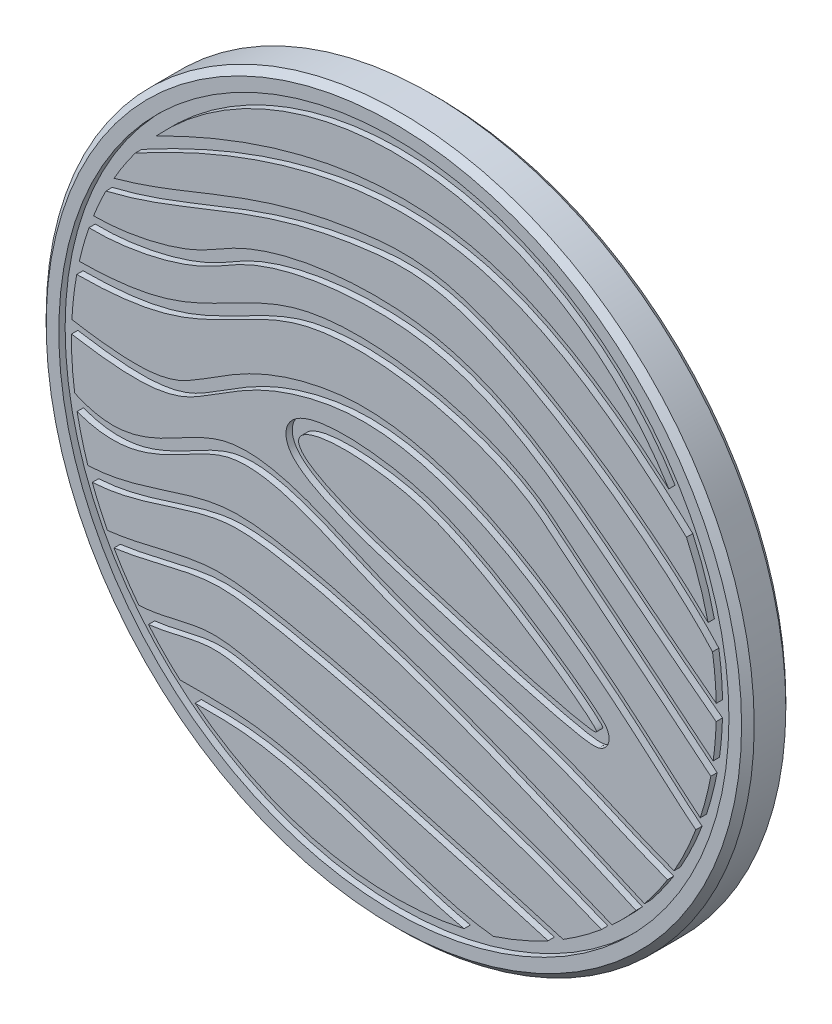
from build123d import *

# Parameters (mm, degrees)
SKETCH2_R                 = 44.45
BOSS_EXTRUDE1_DEPTH       = 5.55625
CHAMFER1_SIZE             = 0.79375
F_6_32_TAPPED_HOLE1_D     = 2.7051
F_6_32_TAPPED_HOLE1_DEPTH = 4.26730597
F_6_32_TAPPED_HOLE1_TIP   = 0.81269403
THREAD1_PITCH             = 0.79375
CIRPATTERN1_COUNT         = 3
CUT_EXTRUDE1_START        = -0.79375
CUT_EXTRUDE1_DEPTH        = 0.79375
SKETCH11_R                = 43.65625
SKETCH11_R_2              = 42.06875
BOSS_EXTRUDE2_DEPTH       = 5.55625
SKETCH11_3_R              = 42.06875
SKETCH11_3_R_2            = 40.48125
CUT_EXTRUDE2_DEPTH        = 0.79375


# Read off the part's stored shape, not the designer's step: Cut-Extrude1
with BuildPart() as part:
    # Sketch2 → Boss-Extrude1 (new body)
    with BuildSketch(Plane.XY):
        Circle(SKETCH2_R)
    extrude(amount=BOSS_EXTRUDE1_DEPTH)

    # Chamfer1
    chamfer1_edges = [part.edges().sort_by_distance(p)[0] for p in [
        (-44.45, 0, 0),
        (-44.45, 0, 5.55625),
    ]]
    chamfer(chamfer1_edges, length=CHAMFER1_SIZE)

    # #6-32 Tapped Hole1
    with Locations(Plane(origin=(0, 0, 0), x_dir=(-1, 0, 0), z_dir=(0, 0, -1))):
        with Locations((-21.997045256, -12.7), (0, 25.4), (21.997045256, -12.7)):
            Hole(F_6_32_TAPPED_HOLE1_D / 2, depth=F_6_32_TAPPED_HOLE1_DEPTH)
            with Locations((0, 0, -(F_6_32_TAPPED_HOLE1_DEPTH + F_6_32_TAPPED_HOLE1_TIP / 2))):  # 118° drill point
                Cone(0, F_6_32_TAPPED_HOLE1_D / 2, F_6_32_TAPPED_HOLE1_TIP, mode=Mode.SUBTRACT)

    # Thread1: the profile of Thread Profile1 profile screwed along a right-hand helix of 9.44 turns, 8 arcs to a turn; built about Z, then put on its axis
    thread1_z = Axis((0, 0, 0), (0, 0, 1))
    thread1_corners = [(1.35225, 0, -0.000173205), (1.782179788, 0, 0.248046874), (1.782179788, 0, 0.347265624), (1.35225, 0, 0.595485703)]
    with BuildLine(mode=Mode.PRIVATE) as thread1_profile:
        Line(thread1_corners[0], thread1_corners[1])
        Line(thread1_corners[1], thread1_corners[2])
        Line(thread1_corners[2], thread1_corners[3])
        Line(thread1_corners[3], thread1_corners[0])
    thread1_cap = Face(thread1_profile.wire())
    thread1_turn_angles = [0, 22.5, 45, 67.5, 90, 112.5, 135, 157.5, 180, 202.5, 225, 247.5, 270, 292.5, 315, 337.5, 360]
    thread1_turn_weights = [1, 0.9238795325112867, 1, 0.9238795325112867, 1, 0.9238795325112867, 1, 0.9238795325112867, 1, 0.9238795325112867, 1, 0.9238795325112867, 1, 0.9238795325112867, 1, 0.9238795325112867, 1]
    thread1_turn_rails = [Edge.make_bspline([Vector(p[0], p[1], 0).rotate(thread1_z, thread1_turn_angles[k]) / thread1_turn_weights[k] + Vector(0, 0, p[2] + THREAD1_PITCH * thread1_turn_angles[k] / 360) for k in range(17)], [0, 0, 0, 1, 1, 2, 2, 3, 3, 4, 4, 5, 5, 6, 6, 7, 7, 8, 8, 8], 2, thread1_turn_weights) for p in thread1_corners]
    thread1_turn_sides = [Face.make_surface_from_curves(thread1_turn_rails[p[0]], thread1_turn_rails[p[1]]) for p in [(0, 1), (1, 2), (2, 3), (3, 0)]]
    thread1_last_angles = [3240, 3262.5, 3285, 3307.5, 3330, 3352.5, 3375, 3386.7, 3398.4]
    thread1_last_weights = [1, 0.9238795325112867, 1, 0.9238795325112867, 1, 0.9238795325112867, 1, 0.9792228106217656, 1]
    thread1_last_rails = [Edge.make_bspline([Vector(p[0], p[1], 0).rotate(thread1_z, thread1_last_angles[k]) / thread1_last_weights[k] + Vector(0, 0, p[2] + THREAD1_PITCH * thread1_last_angles[k] / 360) for k in range(9)], [0, 0, 0, 1, 1, 2, 2, 3, 3, 4, 4, 4], 2, thread1_last_weights) for p in thread1_corners]
    thread1_last_sides = [Face.make_surface_from_curves(thread1_last_rails[p[0]], thread1_last_rails[p[1]]) for p in [(0, 1), (1, 2), (2, 3), (3, 0)]]
    thread1 = Plane(origin=(0, 25.4, -2.54), x_dir=(1, 0, 0), z_dir=(0, 0, 1)) * Solid(Shell([*[p.moved(Location((0, 0, THREAD1_PITCH * i))) for i in range(9) for p in thread1_turn_sides], *thread1_last_sides, thread1_cap, thread1_cap.rotate(thread1_z, 3398.4).moved(Location((0, 0, THREAD1_PITCH * 3398.4 / 360)))]))
    add(thread1, mode=Mode.SUBTRACT)

    # CirPattern1: Thread1 ×3 about axis
    cirpattern1_axis = Axis((0, 0, 0), (0, 0, -1))
    for i in range(1, CIRPATTERN1_COUNT):
        add(thread1.rotate(cirpattern1_axis, i * 360 / CIRPATTERN1_COUNT), mode=Mode.SUBTRACT)

    # Cut-Extrude1 outline → Cut-Extrude1 (cut)
    # profile 1 of 11: a face of its own
    with BuildSketch(Plane.XY.offset(5.55625).offset(CUT_EXTRUDE1_START)):
        with BuildLine():
            Line((-40.065770572, 14.894112055), (-40.290915103, 13.322658527))
            add(Edge.make_bspline(
                [(-40.290915103, 13.322658527), (-35.652614696, 12.658122191), (-26.162766955, 14.34011724), (-15.202344718, 21.571498622), (-1.273743299, 22.915529266), (17.343991984, 18.766368422), (25.846086804, 9.69300545), (42.004879348, -2.321111243)],
                knots=[0, 0, 0, 0, 0.168898225, 0.216178889, 0.444292441, 0.525525971, 1, 1, 1, 1], degree=3))
            Line((42.004879348, -2.321111243), (42.95207413, -1.047149589))
            add(Edge.make_bspline(
                [(42.95207413, -1.047149589), (42.430807085, -0.659585785), (41.37893192, 0.127558205), (39.377833896, 1.643154799), (36.996004718, 3.476854604), (34.32802197, 5.564907), (30.987754435, 8.205116842), (27.167734452, 11.234179487), (22.974105279, 14.439092091), (18.991346404, 17.213446171), (15.047041374, 19.550461508), (10.9582111, 21.427279627), (6.634795826, 22.836181801), (1.637745147, 23.706079637), (-4.451280899, 23.827531353), (-9.875124503, 23.244973181), (-14.135807845, 22.304112425), (-17.210069084, 21.343678617), (-19.62565754, 20.306761643), (-21.394283838, 19.331110792), (-23.021182017, 18.368439642), (-25.034517224, 17.302780308), (-28.011831433, 16.226036352), (-31.227110262, 15.40293169), (-33.940523292, 14.964304288), (-36.014796812, 14.778241243), (-37.494531835, 14.724470959), (-38.634925077, 14.752476487), (-39.483240563, 14.819683436), (-39.868977045, 14.865917148), (-40.065770572, 14.894112055)],
                knots=[0, 0, 0, 0, 0.015625, 0.03125, 0.0625, 0.09375, 0.125, 0.1875, 0.25, 0.3125, 0.375, 0.4375, 0.5, 0.5625, 0.625, 0.6875, 0.71875, 0.75, 0.78125, 0.796875, 0.8125, 0.84375, 0.875, 0.90625, 0.9375, 0.953125, 0.96875, 0.984375, 0.9921875, 1, 1, 1, 1], degree=3))
        make_face()
    # profile 2 of 11: a face of its own
    with BuildSketch(Plane.XY.offset(5.55625).offset(CUT_EXTRUDE1_START)):
        with BuildLine():
            Line((-41.707497708, 8.922969699), (-41.744209771, 7.335894252))
            add(Edge.make_bspline(
                [(-41.744209771, 7.335894252), (-28.463035441, 7.028675519), (-23.359930236, 10.992022559), (-5.585705017, 19.112497292), (13.204846606, 14.496458286), (24.220701504, 5.010268849), (29.752659492, 0.914309116), (41.274945246, -8.685471458)],
                knots=[0, 0, 0, 0, 0.272981808, 0.341363907, 0.645770198, 0.715438886, 1, 1, 1, 1], degree=3))
            Line((41.274945246, -8.685471458), (42.291105274, -7.4658096))
            add(Edge.make_bspline(
                [(42.291105274, -7.4658096), (41.97972642, -7.206384626), (41.348881483, -6.681418972), (40.148288233, -5.684738272), (38.716248372, -4.500264999), (37.114144695, -3.181606948), (35.118626407, -1.54713116), (32.872045296, 0.279279473), (30.514377014, 2.17959842), (28.437671641, 3.843115137), (25.967844194, 5.817138715), (23.828519339, 7.538658872), (21.799872184, 9.213060226), (20.242292966, 10.538056348), (18.419194675, 11.946775227), (15.4381988, 13.771050341), (10.87230029, 15.757530017), (4.497009821, 17.538924667), (-2.294613307, 18.471757783), (-7.893872599, 18.332090048), (-12.123208008, 17.515241664), (-15.056752015, 16.507135895), (-17.667100975, 15.312693436), (-20.75840201, 13.737857417), (-23.493777795, 12.289563751), (-26.29307117, 11.07018114), (-28.546477753, 10.284279242), (-31.079794829, 9.644646527), (-33.529086932, 9.253986521), (-35.751292734, 9.04251228), (-37.562099097, 8.938605878), (-39.207010777, 8.901191191), (-40.601516464, 8.902628277), (-41.342535228, 8.914527425), (-41.707497708, 8.922969699)],
                knots=[0, 0, 0, 0, 0.0078125, 0.015625, 0.03125, 0.046875, 0.0625, 0.09375, 0.125, 0.15625, 0.1875, 0.25, 0.28125, 0.3125, 0.34375, 0.375, 0.4375, 0.5, 0.5625, 0.625, 0.65625, 0.6875, 0.71875, 0.75, 0.8125, 0.84375, 0.875, 0.90625, 0.9375, 0.953125, 0.96875, 0.984375, 0.9921875, 1, 1, 1, 1], degree=3))
        make_face()
    # profile 3 of 11: a face of its own
    with BuildSketch(Plane.XY.offset(5.55625).offset(CUT_EXTRUDE1_START)):
        with BuildLine():
            Line((-37.960499586, -18.719178437), (-37.934558246, -20.306466469))
            add(Edge.make_bspline(
                [(-37.934558246, -20.306466469), (-37.135621137, -20.293409293), (-35.529150766, -20.173228614), (-32.428206014, -19.674369997), (-28.709981514, -18.76967393), (-25.252598689, -17.989823695), (-22.719951548, -17.705862048), (-20.296916149, -17.714751124), (-17.163988296, -18.162169072), (-13.089577942, -18.926987528), (-8.886181837, -19.827006585), (-3.122841562, -21.212434322), (4.245818431, -23.239341864), (11.544975721, -25.555168907), (17.164777304, -27.515113786), (21.227516041, -29.023067867), (24.443836292, -30.295064971), (26.905530769, -31.318943134), (28.074171638, -31.822182397), (28.663704926, -32.080785481)],
                knots=[0, 0, 0, 0, 0.03125, 0.0625, 0.125, 0.1875, 0.21875, 0.25, 0.3125, 0.375, 0.4375, 0.5, 0.625, 0.75, 0.8125, 0.875, 0.9375, 0.96875, 1, 1, 1, 1], degree=3))
            Line((28.663704926, -32.080785481), (29.301416697, -30.627004223))
            add(Edge.make_bspline(
                [(29.301416697, -30.627004223), (16.545067994, -25.031338664), (-4.46717989, -18.394529106), (-25.128087234, -15.37971017), (-32.717400763, -18.633489508), (-37.960499586, -18.719178437)],
                knots=[0, 0, 0, 0, 0.680088409, 0.780088409, 1, 1, 1, 1], degree=3))
        make_face()
    # profile 4 of 11: a face of its own
    with BuildSketch(Plane.XY.offset(5.55625).offset(CUT_EXTRUDE1_START)):
        with BuildLine():
            Line((14.270531745, -40.180166422), (14.257495649, -38.592719947))
            add(Edge.make_bspline(
                [(14.257495649, -38.592719947), (6.188429416, -38.658983047), (-11.43655897, -29.436498005), (-24.995536054, -30.358775568), (-28.747838735, -30.271103868)],
                knots=[0, 0, 0, 0, 0.75791741, 1, 1, 1, 1], degree=3))
            Line((-28.747838735, -30.271103868), (-28.784920192, -31.858170727))
            add(Edge.make_bspline(
                [(-28.784920192, -31.858170727), (-28.298853804, -31.869527558), (-27.313949233, -31.882315333), (-25.444312472, -31.880802376), (-22.299210181, -31.851329546), (-18.099054978, -31.968301597), (-12.638464395, -33.031063101), (-6.901821924, -34.683908593), (-1.14661117, -36.59229918), (3.499147894, -38.108485606), (7.034553508, -39.104114777), (9.578830246, -39.69776047), (11.594946068, -40.026208347), (13.148788986, -40.162504883), (13.893846404, -40.183259759), (14.270531745, -40.180166422)],
                knots=[0, 0, 0, 0, 0.03125, 0.0625, 0.125, 0.25, 0.375, 0.5, 0.625, 0.75, 0.8125, 0.875, 0.9375, 0.96875, 1, 1, 1, 1], degree=3))
        make_face()
    # profile 5 of 11: a face of its own
    with BuildSketch(Plane.XY.offset(5.55625).offset(CUT_EXTRUDE1_START)):
        with BuildLine():
            Line((39.530038185, -15.34497805), (40.317531759, -13.966569503))
            add(Edge.make_bspline(
                [(40.317531759, -13.966569503), (40.252393578, -13.929355646), (40.1311313, -13.856732991), (39.834669253, -13.665959797), (39.413794041, -13.37025573), (38.828599012, -12.925422728), (37.957022307, -12.226169768), (36.708233762, -11.170638022), (34.983683902, -9.66697276), (33.051921306, -7.974108529), (30.221171763, -5.525852052), (26.240290229, -2.219183931), (20.858833758, 1.791695689), (14.96756451, 5.496531594), (8.65188151, 8.544836172), (1.994881851, 10.568276687), (-4.930377478, 11.196209802), (-10.770102846, 10.157744919), (-14.761392196, 8.876414832), (-18.149385308, 7.449092028), (-20.883388212, 5.843642948), (-23.415404862, 4.225061943), (-25.054957225, 3.188372929), (-26.358364178, 2.474700784), (-27.647227445, 1.914836205), (-29.429821656, 1.446610093), (-31.953803241, 1.228325675), (-34.446486305, 1.323598473), (-36.70115962, 1.553015651), (-38.527841207, 1.796811724), (-40.172360016, 2.05627249), (-41.556325925, 2.293363115), (-42.286023413, 2.423890549), (-42.64584811, 2.489373937)],
                knots=[0, 0, 0, 0, 0.0078125, 0.015625, 0.03125, 0.046875, 0.0625, 0.09375, 0.125, 0.15625, 0.1875, 0.25, 0.3125, 0.375, 0.4375, 0.5, 0.5625, 0.625, 0.65625, 0.6875, 0.75, 0.78125, 0.8125, 0.828125, 0.84375, 0.875, 0.90625, 0.9375, 0.953125, 0.96875, 0.984375, 0.9921875, 1, 1, 1, 1], degree=3))
            Line((-42.64584811, 2.489373937), (-42.930083849, 0.927526859))
            add(Edge.make_bspline(
                [(-42.930083849, 0.927526859), (-35.151503919, -0.488072945), (-29.010155542, -0.986366304), (-21.159727714, 3.662044173), (-16.562888304, 7.070194939), (11.543155872, 13.962358908), (33.775389698, -12.057310753), (39.530038185, -15.34497805)],
                knots=[0, 0, 0, 0, 0.164401254, 0.201100448, 0.348559545, 0.430292739, 1, 1, 1, 1], degree=3))
        make_face()
    # profile 6 of 11: a face of its own
    with BuildSketch(Plane.XY.offset(5.55625).offset(CUT_EXTRUDE1_START)):
        with BuildLine():
            Line((32.629288954, -27.708999352), (33.264486005, -26.254117585))
            add(Edge.make_bspline(
                [(33.264486005, -26.254117585), (20.206984276, -20.553251171), (-0.962427083, -10.813151934), (-24.708940699, -7.769634186), (-33.163884821, -13.169636298), (-40.193010915, -12.732414162)],
                knots=[0, 0, 0, 0, 0.648138892, 0.748138892, 1, 1, 1, 1], degree=3))
            Line((-40.193010915, -12.732414162), (-40.291565314, -14.316852005))
            add(Edge.make_bspline(
                [(-40.291565314, -14.316852005), (-39.821924513, -14.346064364), (-38.872529617, -14.369498997), (-37.036638531, -14.287203261), (-33.925965048, -13.853879291), (-29.799824499, -12.67187506), (-25.23495254, -11.128709886), (-21.750844375, -10.32080903), (-19.060515085, -10.237459487), (-16.263662729, -10.451481449), (-12.559102463, -11.116185291), (-7.954345135, -12.171360812), (-1.685718804, -13.926801772), (6.288251176, -16.635733031), (14.150108685, -19.741683162), (20.200178753, -22.28404528), (24.577638588, -24.176043265), (28.050572516, -25.700318046), (30.718333176, -26.872673925), (31.986529144, -27.428372331), (32.629288954, -27.708999352)],
                knots=[0, 0, 0, 0, 0.015625, 0.03125, 0.0625, 0.125, 0.1875, 0.25, 0.28125, 0.3125, 0.375, 0.4375, 0.5, 0.625, 0.75, 0.8125, 0.875, 0.9375, 0.96875, 1, 1, 1, 1], degree=3))
        make_face()
    # profile 7 of 11: a face of its own
    with BuildSketch(Plane.XY.offset(5.55625).offset(CUT_EXTRUDE1_START)):
        with BuildLine():
            Line((-37.962419608, 19.429812575), (-37.637248362, 17.875972201))
            add(Edge.make_bspline(
                [(-37.637248362, 17.875972201), (-25.710556578, 20.371863862), (-17.281435371, 27.416220826), (13.33768026, 29.517565445), (38.820134001, 9.366784017), (42.061567701, 3.424768746)],
                knots=[0, 0, 0, 0, 0.552928513, 0.652928513, 1, 1, 1, 1], degree=3))
            Line((42.061567701, 3.424768746), (43.455193945, 4.185006959))
            add(Edge.make_bspline(
                [(43.455193945, 4.185006959), (43.266703905, 4.530536376), (42.863215398, 5.169668771), (42.064515043, 6.234231898), (41.111392959, 7.353613802), (39.634422521, 8.938356257), (37.431435316, 11.06675436), (34.304916141, 13.783241521), (30.792252263, 16.571507375), (25.72524561, 20.260515764), (18.918208056, 24.580983756), (12.140133703, 27.870745672), (7.064761701, 29.5024983), (2.35369459, 30.285590914), (-1.672257123, 30.043133982), (-5.175177883, 29.574748811), (-8.503427605, 29.017138053), (-12.314137083, 28.151583943), (-16.447325219, 26.920063412), (-20.239176703, 25.566382176), (-23.796060312, 24.163853483), (-27.226750792, 22.782179444), (-30.641618579, 21.48665984), (-33.577525492, 20.5270515), (-36.027591671, 19.862380904), (-37.320338183, 19.564180572), (-37.962419608, 19.429812575)],
                knots=[0, 0, 0, 0, 0.015625, 0.03125, 0.046875, 0.0625, 0.09375, 0.125, 0.15625, 0.1875, 0.25, 0.3125, 0.34375, 0.375, 0.4375, 0.46875, 0.5, 0.5625, 0.625, 0.6875, 0.75, 0.8125, 0.875, 0.9375, 0.96875, 1, 1, 1, 1], degree=3))
        make_face()
    # profile 8 of 11: a face of its own
    with BuildSketch(Plane.XY.offset(5.55625).offset(CUT_EXTRUDE1_START)):
        with BuildLine():
            Line((38.480198356, 15.420367853), (39.530038185, 16.611162789))
            add(Edge.make_bspline(
                [(39.530038185, 16.611162789), (39.40817887, 16.718597545), (39.17776047, 16.924625544), (38.626660489, 17.425604438), (37.842860475, 18.148336796), (36.742082508, 19.1613695), (35.080711968, 20.667023053), (32.657556383, 22.783871456), (29.253243865, 25.517557043), (25.402637313, 28.266272639), (19.742496487, 31.715710056), (11.764730519, 35.157716602), (3.008942902, 36.265070737), (-4.406630037, 35.815870547), (-10.178870749, 34.81789393), (-16.163743924, 33.170912509), (-21.333464514, 31.265093935), (-25.582376407, 29.424093371), (-28.825776457, 27.886393021), (-31.579218174, 26.473331099), (-33.806922096, 25.267562921), (-34.939120553, 24.633964625), (-35.499687816, 24.315262804)],
                knots=[0, 0, 0, 0, 0.015625, 0.03125, 0.0625, 0.09375, 0.125, 0.1875, 0.25, 0.3125, 0.375, 0.5, 0.625, 0.6875, 0.75, 0.8125, 0.875, 0.90625, 0.9375, 0.96875, 0.984375, 1, 1, 1, 1], degree=3))
            Line((-35.499687816, 24.315262804), (-34.715079986, 22.935209616))
            add(Edge.make_bspline(
                [(-34.715079986, 22.935209616), (-16.261081286, 33.426944281), (13.936654505, 40.047676771), (34.79204081, 18.671955989), (38.480198356, 15.420367853)],
                knots=[0, 0, 0, 0, 0.515810378, 1, 1, 1, 1], degree=3))
        make_face()
    # profile 9 of 11: a face of its own
    with BuildSketch(Plane.XY.offset(5.55625).offset(CUT_EXTRUDE1_START)):
        with BuildLine():
            Line((22.323241176, -36.430070772), (22.776786487, -34.908738165))
            add(Edge.make_bspline(
                [(22.776786487, -34.908738165), (10.475772153, -31.241514212), (-6.029871849, -26.511575109), (-24.490701076, -22.444560765), (-29.919296685, -25.089120119), (-33.318671059, -24.678096204)],
                knots=[0, 0, 0, 0, 0.715646329, 0.815646329, 1, 1, 1, 1], degree=3))
            Line((-33.318671059, -24.678096204), (-33.509230381, -26.254117585))
            add(Edge.make_bspline(
                [(-33.509230381, -26.254117585), (-32.839829514, -26.335055939), (-31.462987159, -26.355044964), (-29.542321284, -26.095365932), (-27.698424794, -25.697083186), (-25.945905851, -25.279450962), (-24.277066263, -24.949017684), (-22.749955662, -24.80104684), (-21.224442297, -24.888910562), (-19.07126759, -25.243928478), (-16.158499842, -25.941699395), (-12.629018145, -26.775124374), (-9.062652434, -27.663146061), (-4.281786017, -28.888607216), (1.711192836, -30.4928132), (8.825714573, -32.480967268), (14.593485802, -34.146630981), (19.077644157, -35.465031524), (21.234671961, -36.105542486), (22.323241176, -36.430070772)],
                knots=[0, 0, 0, 0, 0.03125, 0.0625, 0.09375, 0.125, 0.15625, 0.1875, 0.21875, 0.25, 0.3125, 0.375, 0.4375, 0.5, 0.625, 0.75, 0.875, 0.9375, 1, 1, 1, 1], degree=3))
        make_face()
    # profile 10 of 11: a face of its own
    with BuildSketch(Plane.XY.offset(5.55625).offset(CUT_EXTRUDE1_START)):
        with BuildLine():
            add(Edge.make_bspline(
                [(-2.938515984, -3.825590918), (-1.511905227, -4.306132608), (1.679257958, -5.301018855), (6.137316027, -6.655988146), (10.265694887, -7.873508158), (13.999959701, -8.936848718), (17.293555544, -9.833913614), (19.629593398, -10.432060045), (21.231532577, -10.814972029), (22.29524332, -11.053001657), (23.218693024, -11.240664725), (23.872206789, -11.354260462), (24.332177297, -11.418886053), (24.650373504, -11.453741373), (24.951290825, -11.474139849), (25.252177286, -11.475038559), (25.581060715, -11.4481206), (25.986142746, -11.325855144), (26.394495338, -11.107313715), (26.845659585, -10.619421893), (27.056924343, -9.927654448), (27.000450906, -9.37822562), (26.828192577, -8.907873259), (26.610990589, -8.594116772), (26.378175696, -8.323571286), (26.127272061, -8.074225), (25.7411225, -7.720196642), (25.137173496, -7.20930585), (24.215411478, -6.478475621), (23.111980883, -5.64378569), (21.424736996, -4.415860059), (18.964120664, -2.713837601), (15.627533634, -0.566301941), (12.085681825, 1.522534917), (8.518305102, 3.385338985), (5.073827574, 4.870072376), (1.942719041, 5.768690629), (-0.848472809, 6.275812481), (-3.487565952, 6.596757702), (-5.908362277, 6.713103307), (-8.072298307, 6.640144995), (-9.946570021, 6.374260791), (-11.264301058, 5.976494644), (-12.197610485, 5.478568454), (-12.837485205, 4.964099514), (-13.384318692, 4.203982155), (-13.624273443, 3.17296137), (-13.424087645, 2.172446518), (-12.968016938, 1.375066402), (-12.36246083, 0.701387548), (-11.360597864, -0.12626919), (-9.695357947, -1.13375689), (-6.880406579, -2.417768718), (-4.36512674, -3.345049229), (-2.938515984, -3.825590918)],
                knots=[0, 0, 0, 0, 0.03125, 0.0625, 0.09375, 0.125, 0.15625, 0.1875, 0.203125, 0.21875, 0.234375, 0.25, 0.2578125, 0.265625, 0.2734375, 0.28125, 0.2890625, 0.29296875, 0.296875, 0.30078125, 0.3046875, 0.30859375, 0.3125, 0.3203125, 0.328125, 0.3359375, 0.34375, 0.359375, 0.375, 0.390625, 0.40625, 0.4375, 0.46875, 0.5, 0.53125, 0.5625, 0.59375, 0.625, 0.65625, 0.6875, 0.71875, 0.75, 0.78125, 0.796875, 0.8125, 0.828125, 0.84375, 0.859375, 0.875, 0.890625, 0.90625, 0.9375, 0.96875, 1, 1, 1, 1], degree=3))
        make_face()
        with BuildLine():
            add(Edge.make_bspline(
                [(-2.431863087, -2.321111243), (-1.051215, -2.786062258), (12.938286763, -7.153060561), (25.358560536, -10.449417943), (25.753840159, -9.235495116), (9.575837273, 2.36667864), (-4.393385992, 5.569717056), (-14.671662129, 4.862131814), (-11.224088043, 0.639783684), (-2.431863087, -2.321111243)],
                knots=[0, 0, 0, 0, 0.030701295, 0.276311655, 0.335598735, 0.564285019, 0.614032566, 0.804488418, 1, 1, 1, 1], degree=3))
        make_face(mode=Mode.SUBTRACT)
    # profile 11 of 11: a face of its own
    with BuildSketch(Plane.XY.offset(5.55625).offset(CUT_EXTRUDE1_START)):
        with BuildLine():
            Line((36.236680782, -22.092037096), (36.755931313, -20.591858728))
            add(Edge.make_bspline(
                [(36.755931313, -20.591858728), (31.077666914, -18.62646457), (21.51929271, -13.78068125), (8.570412253, -10.430720776), (-6.059586785, -5.193160611), (-22.316244754, 4.137070266), (-32.859044928, -10.293899297), (-41.744209771, -4.806275545)],
                knots=[0, 0, 0, 0, 0.199498919, 0.428528305, 0.488903958, 0.742879802, 1, 1, 1, 1], degree=3))
            Line((-41.744209771, -4.806275545), (-42.57839977, -6.156935863))
            add(Edge.make_bspline(
                [(-42.57839977, -6.156935863), (-42.291607008, -6.334063784), (-41.699262212, -6.678758755), (-40.554562434, -7.261003487), (-39.143568024, -7.825912332), (-37.49908606, -8.248004187), (-35.374056696, -8.497460701), (-32.876037646, -8.27768221), (-29.279236741, -7.14488333), (-26.182078786, -5.401716579), (-23.333804648, -3.922534272), (-21.31479125, -3.12530231), (-19.349177949, -2.782851684), (-16.493896516, -2.837024207), (-12.594877596, -3.775473144), (-7.570419831, -5.80375052), (-3.252861982, -7.747594783), (0.22546898, -9.124298002), (3.642589437, -10.339909327), (7.861690805, -11.691795846), (12.807721763, -13.187871126), (17.585865987, -14.682984256), (22.102144602, -16.300853107), (25.740491038, -17.856085866), (28.759811421, -19.15966589), (31.107966964, -20.150163155), (33.168788901, -20.972513997), (34.889024235, -21.616623506), (35.789488873, -21.937252411), (36.236680782, -22.092037096)],
                knots=[0, 0, 0, 0, 0.0078125, 0.015625, 0.03125, 0.046875, 0.0625, 0.09375, 0.125, 0.1875, 0.21875, 0.25, 0.28125, 0.3125, 0.375, 0.4375, 0.5, 0.53125, 0.5625, 0.625, 0.6875, 0.75, 0.8125, 0.875, 0.90625, 0.9375, 0.96875, 0.984375, 1, 1, 1, 1], degree=3))
        make_face()
    extrude(amount=CUT_EXTRUDE1_DEPTH, mode=Mode.SUBTRACT)

    # Sketch11 → Boss-Extrude2 (add)
    with BuildSketch(Plane.XY.offset(5.55625)):
        Circle(SKETCH11_R)
        Circle(SKETCH11_R_2, mode=Mode.SUBTRACT)
    extrude(amount=-BOSS_EXTRUDE2_DEPTH)

    # Sketch11<3> → Cut-Extrude2 (cut)
    with BuildSketch(Plane.XY.offset(5.55625)):
        Circle(SKETCH11_3_R)
        Circle(SKETCH11_3_R_2, mode=Mode.SUBTRACT)
    extrude(amount=-CUT_EXTRUDE2_DEPTH, mode=Mode.SUBTRACT)


solid = part.part
